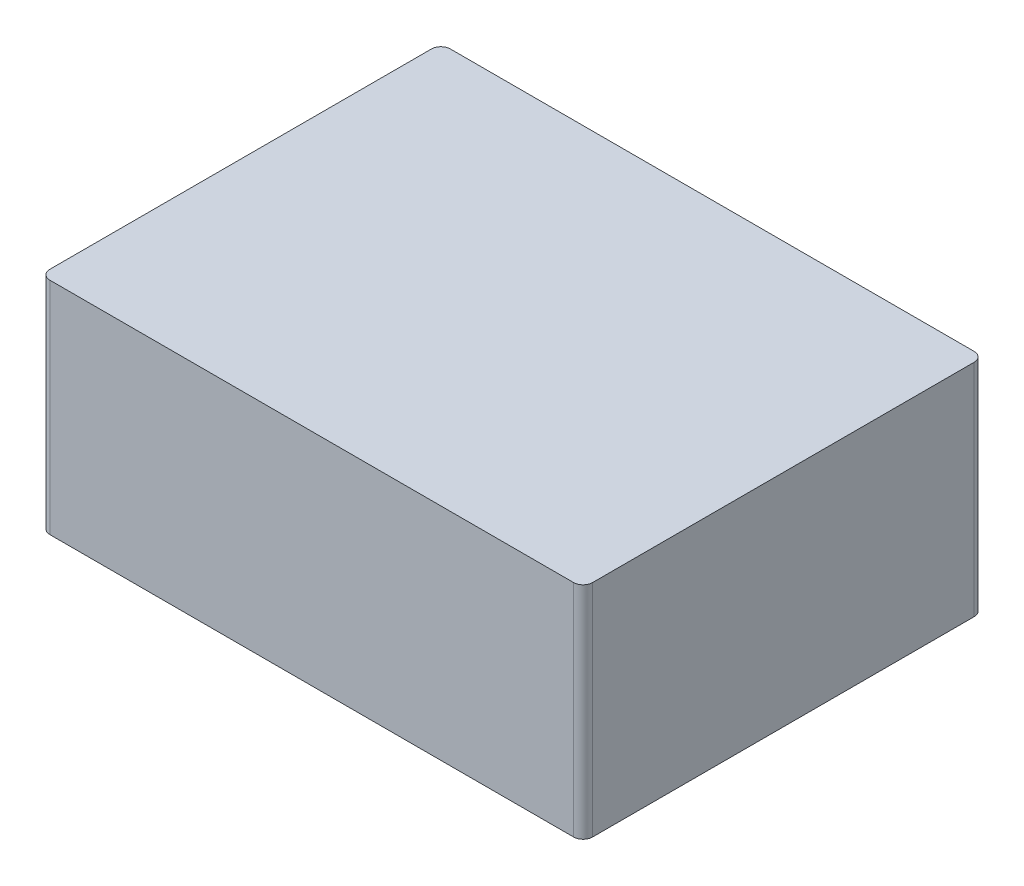
from build123d import *

# Parameters (mm, degrees)
SKETCH1_W           = 114.5
SKETCH1_H           = 84.5
BOSS_EXTRUDE3_DEPTH = 46.5
FILLET2_R           = 2
FILLET3_R           = 2
FILLET4_R           = 2
FILLET5_R           = 2


with BuildPart() as part:
    # Sketch1 → Boss-Extrude3 (new body)
    with BuildSketch(Plane(origin=(0, 0, 0), x_dir=(1, 0, 0), z_dir=(0, 1, 0))):
        with Locations((57.25, 42.25)):
            Rectangle(SKETCH1_W, SKETCH1_H)
    extrude(amount=BOSS_EXTRUDE3_DEPTH)

    # Fillet2
    fillet2_edges = [part.edges().sort_by_distance(p)[0] for p in [
        (114.5, 23.25, 0),
    ]]
    fillet(fillet2_edges, radius=FILLET2_R)

    # Fillet3
    fillet3_edges = [part.edges().sort_by_distance(p)[0] for p in [
        (0, 23.25, 0),
    ]]
    fillet(fillet3_edges, radius=FILLET3_R)

    # Fillet4
    fillet4_edges = [part.edges().sort_by_distance(p)[0] for p in [
        (114.5, 23.25, -84.5),
    ]]
    fillet(fillet4_edges, radius=FILLET4_R)

    # Fillet5
    fillet5_edges = [part.edges().sort_by_distance(p)[0] for p in [
        (0, 23.25, -84.5),
    ]]
    fillet(fillet5_edges, radius=FILLET5_R)


solid = part.part
